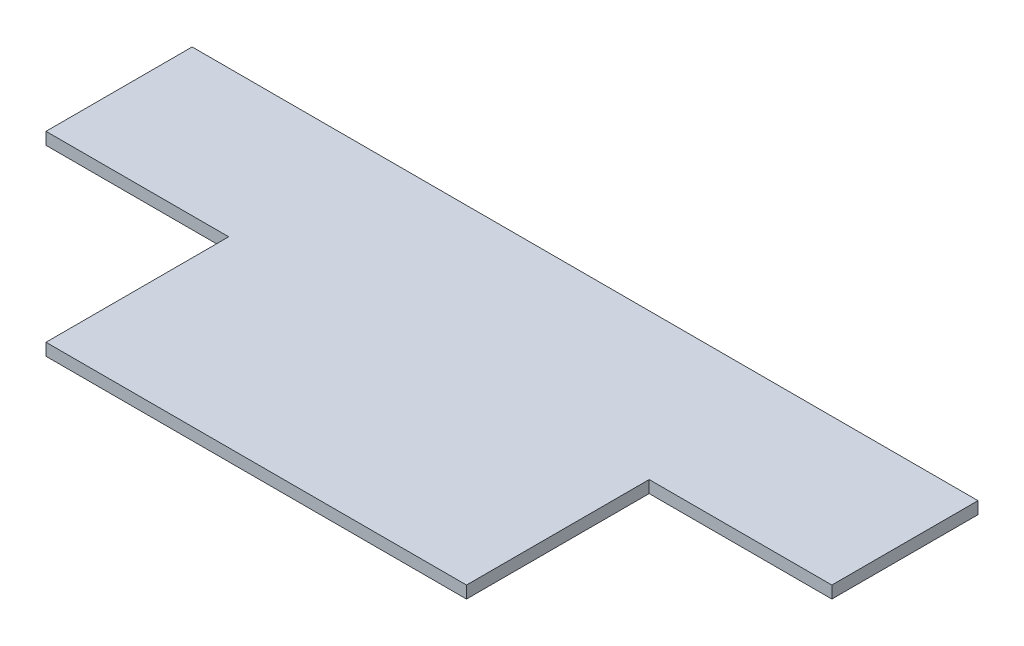
from build123d import *

# Parameters (mm, degrees)
BASE_FLANGE2_DEPTH = 1.5875


# Sheet-metal steps are written as plain solids
with BuildPart() as part:
    # Sketch1 → Base-Flange2 (new body)
    with BuildSketch(Plane(origin=(0, 0, 0), x_dir=(1, 0, 0), z_dir=(0, 1, 0))):
        Polygon((0, 0), (102.4382, 0), (102.4382, -19.05), (78.6257, -19.05), (78.6257, -42.8625), (23.8125, -42.8625), (23.8125, -19.05), (0, -19.05), align=None)
    extrude(amount=-BASE_FLANGE2_DEPTH)


solid = part.part
